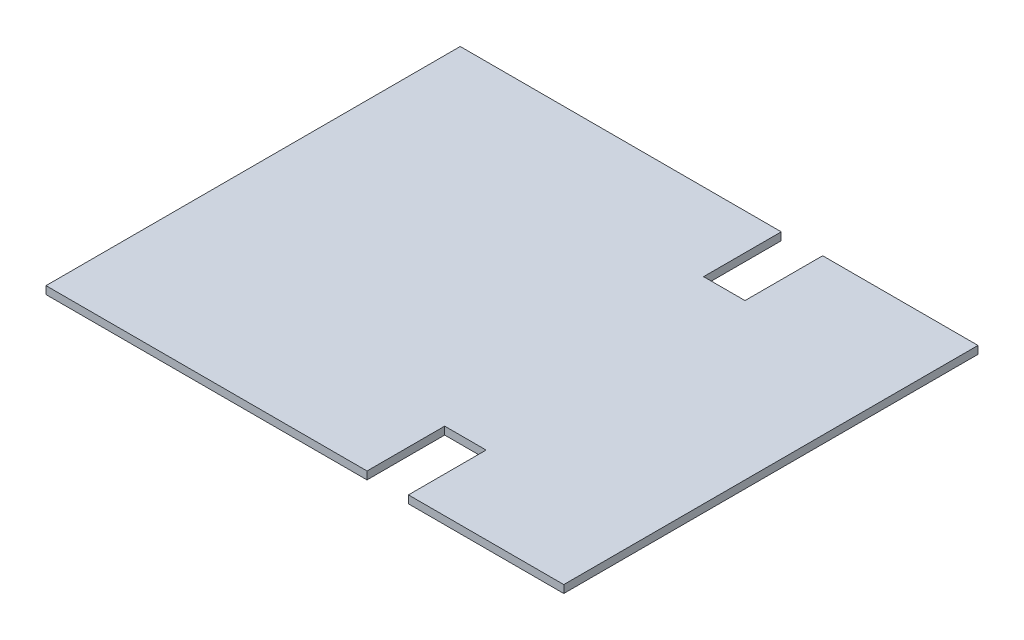
from build123d import *

# Parameters (mm, degrees)
SKETCH1_W           = 100
SKETCH1_H           = 80
BOSS_EXTRUDE1_DEPTH = 1.5
CUT_EXTRUDE1_REACH  = 130.071
SKETCH2_W           = 8
SKETCH2_H           = 15


with BuildPart() as part:
    # Sketch1 → Boss-Extrude1 (new body)
    with BuildSketch(Plane(origin=(0, 0, 0), x_dir=(1, 0, 0), z_dir=(0, 1, 0))):
        with Locations((50, 40)):
            Rectangle(SKETCH1_W, SKETCH1_H)
    extrude(amount=BOSS_EXTRUDE1_DEPTH)

    # Sketch2 → Cut-Extrude1 (cut, up to next)
    with BuildSketch(Plane(origin=(0, 1.5, 0), x_dir=(1, 0, 0), z_dir=(0, 1, 0)), mode=Mode.PRIVATE) as cut_extrude1_sk1:
        with Locations((66, 72.5)):
            Rectangle(SKETCH2_W, SKETCH2_H)
    cut_extrude1_tool1 = extrude(cut_extrude1_sk1.sketch, amount=-CUT_EXTRUDE1_REACH, mode=Mode.PRIVATE) & part.part
    # Sketch2 → Cut-Extrude1 (cut, up to next)
    with BuildSketch(Plane(origin=(0, 1.5, 0), x_dir=(1, 0, 0), z_dir=(0, 1, 0)), mode=Mode.PRIVATE) as cut_extrude1_sk2:
        with Locations((66, 7.5)):
            Rectangle(SKETCH2_W, SKETCH2_H)
    cut_extrude1_tool2 = extrude(cut_extrude1_sk2.sketch, amount=-CUT_EXTRUDE1_REACH, mode=Mode.PRIVATE) & part.part
    add(cut_extrude1_tool1.solids().sort_by_distance((66, 1.5, -72.5))[0], mode=Mode.SUBTRACT)
    add(cut_extrude1_tool2.solids().sort_by_distance((66, 1.5, -7.5))[0], mode=Mode.SUBTRACT)


solid = part.part
